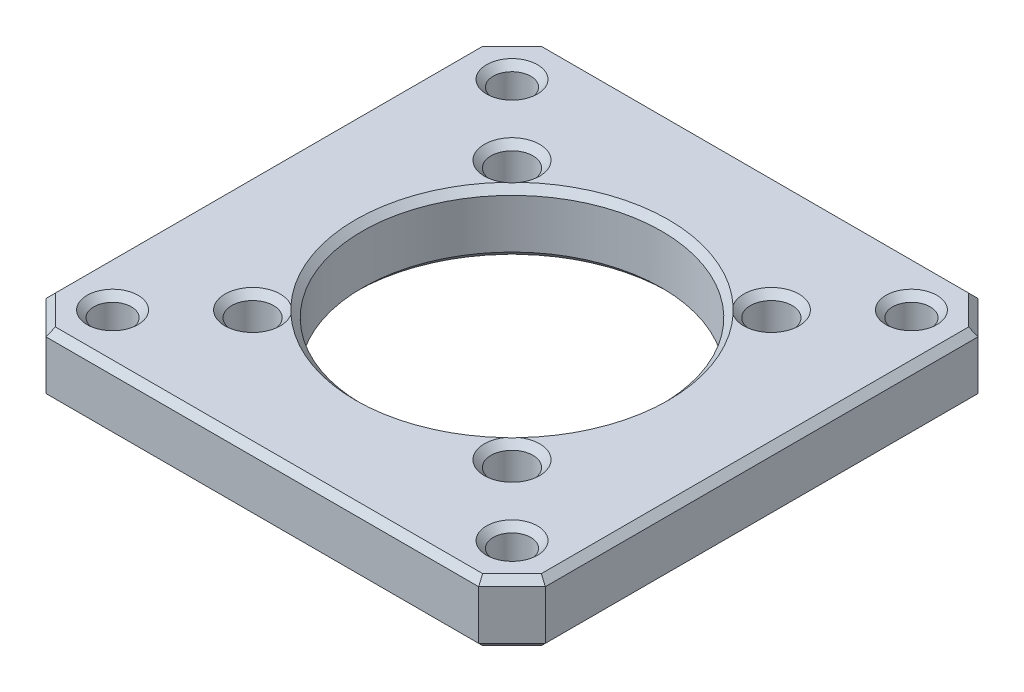
from build123d import *

# Parameters (mm, degrees)
SKETCH1_W           = 38.1
SKETCH1_H           = 38.1
SKETCH1_R           = 11.43
BOSS_EXTRUDE1_DEPTH = 4.7625
SKETCH2_R           = 1.6002
SKETCH2_R_2         = 1.4351
CUT_EXTRUDE1_DEPTH  = 28.358479604
CIRPATTERN1_COUNT   = 4
CHAMFER1_SIZE       = 2.54
CHAMFER2_SIZE       = 0.508


with BuildPart() as part:
    # Sketch1 → Boss-Extrude1 (new body)
    with BuildSketch(Plane(origin=(0, 0, 0), x_dir=(1, 0, 0), z_dir=(0, 1, 0))):
        Rectangle(SKETCH1_W, SKETCH1_H)
        with Locations(Location((0, 0, 0), (0, 0, 90))):
            Circle(SKETCH1_R, mode=Mode.SUBTRACT)
    extrude(amount=BOSS_EXTRUDE1_DEPTH)

    # Sketch2 → Cut-Extrude1 (cut, through all)
    with BuildSketch(Plane(origin=(0, 4.7625, 0), x_dir=(1, 0, 0), z_dir=(0, 1, 0))):
        with Locations(Location((9.896242245, 9.896242245, 0), (0, 0, 270))):
            Circle(SKETCH2_R)
        with Locations(Location((15.24, 15.24, 0), (0, 0, 270))):
            Circle(SKETCH2_R_2)
    cut_extrude1 = extrude(amount=-CUT_EXTRUDE1_DEPTH, mode=Mode.SUBTRACT)

    # CirPattern1: Cut-Extrude1 ×4 about axis
    cirpattern1_axis = Axis((0, 0, 0), (0, 1, 0))
    for i in range(1, CIRPATTERN1_COUNT):
        add(cut_extrude1.rotate(cirpattern1_axis, i * 360 / CIRPATTERN1_COUNT), mode=Mode.SUBTRACT)

    # Chamfer1
    chamfer1_edges = [part.edges().sort_by_distance(p)[0] for p in [
        (19.05, 2.38125, 19.05),
        (-19.05, 2.38125, 19.05),
        (-19.05, 2.38125, -19.05),
        (19.05, 2.38125, -19.05),
    ]]
    chamfer(chamfer1_edges, length=CHAMFER1_SIZE)

    # Chamfer2
    # the kernel refuses this chamfer: 0.508 mm, written as the material it takes off along each edge
    with BuildSketch(Plane(origin=(0, 0, 0), x_dir=(0, 0, -1), z_dir=(1, 0, 0))) as chamfer2_piece_1:
        Polygon((11.43 + CHAMFER2_SIZE, 0), (11.43, CHAMFER2_SIZE), (11.43, 0), align=None)
    revolve(axis=Axis((0, 0, 0), (0, 1, 0)), mode=Mode.SUBTRACT)
    with BuildSketch(Plane(origin=(0, 4.7625, 0), x_dir=(0, 0, -1), z_dir=(1, 0, 0))) as chamfer2_piece_2:
        Polygon((11.43 + CHAMFER2_SIZE, 0), (11.43, -CHAMFER2_SIZE), (11.43, 0), align=None)
    revolve(axis=Axis((0, 4.7625, 0), (0, 1, 0)), mode=Mode.SUBTRACT)
    with BuildSketch(Plane(origin=(9.896242245, 0, -9.896242245), x_dir=(0, 0, 1), z_dir=(-1, 0, 0))) as chamfer2_piece_3:
        Polygon((1.6002 + CHAMFER2_SIZE, 0), (1.6002, CHAMFER2_SIZE), (1.6002, 0), align=None)
    revolve(axis=Axis((9.896242245, 0, -9.896242245), (0, 1, 0)), mode=Mode.SUBTRACT)
    with BuildSketch(Plane(origin=(9.896242245, 4.7625, -9.896242245), x_dir=(0, 0, 1), z_dir=(-1, 0, 0))) as chamfer2_piece_4:
        Polygon((1.6002 + CHAMFER2_SIZE, 0), (1.6002, -CHAMFER2_SIZE), (1.6002, 0), align=None)
    revolve(axis=Axis((9.896242245, 4.7625, -9.896242245), (0, 1, 0)), mode=Mode.SUBTRACT)
    with BuildSketch(Plane(origin=(15.24, 0, -15.24), x_dir=(0, 0, 1), z_dir=(-1, 0, 0))) as chamfer2_piece_5:
        Polygon((1.4351 + CHAMFER2_SIZE, 0), (1.4351, CHAMFER2_SIZE), (1.4351, 0), align=None)
    revolve(axis=Axis((15.24, 0, -15.24), (0, 1, 0)), mode=Mode.SUBTRACT)
    with BuildSketch(Plane(origin=(15.24, 4.7625, -15.24), x_dir=(0, 0, 1), z_dir=(-1, 0, 0))) as chamfer2_piece_6:
        Polygon((1.4351 + CHAMFER2_SIZE, 0), (1.4351, -CHAMFER2_SIZE), (1.4351, 0), align=None)
    revolve(axis=Axis((15.24, 4.7625, -15.24), (0, 1, 0)), mode=Mode.SUBTRACT)
    with BuildSketch(Plane(origin=(-15.24, 0, -15.24), x_dir=(1, 0, 0), z_dir=(0, 0, 1))) as chamfer2_piece_7:
        Polygon((1.4351 + CHAMFER2_SIZE, 0), (1.4351, CHAMFER2_SIZE), (1.4351, 0), align=None)
    revolve(axis=Axis((-15.24, 0, -15.24), (0, 1, 0)), mode=Mode.SUBTRACT)
    with BuildSketch(Plane(origin=(-15.24, 4.7625, -15.24), x_dir=(1, 0, 0), z_dir=(0, 0, 1))) as chamfer2_piece_8:
        Polygon((1.4351 + CHAMFER2_SIZE, 0), (1.4351, -CHAMFER2_SIZE), (1.4351, 0), align=None)
    revolve(axis=Axis((-15.24, 4.7625, -15.24), (0, 1, 0)), mode=Mode.SUBTRACT)
    with BuildSketch(Plane(origin=(15.24, 0, 15.24), x_dir=(-1, 0, 0), z_dir=(0, 0, -1))) as chamfer2_piece_9:
        Polygon((1.4351 + CHAMFER2_SIZE, 0), (1.4351, CHAMFER2_SIZE), (1.4351, 0), align=None)
    revolve(axis=Axis((15.24, 0, 15.24), (0, 1, 0)), mode=Mode.SUBTRACT)
    with BuildSketch(Plane(origin=(15.24, 4.7625, 15.24), x_dir=(-1, 0, 0), z_dir=(0, 0, -1))) as chamfer2_piece_10:
        Polygon((1.4351 + CHAMFER2_SIZE, 0), (1.4351, -CHAMFER2_SIZE), (1.4351, 0), align=None)
    revolve(axis=Axis((15.24, 4.7625, 15.24), (0, 1, 0)), mode=Mode.SUBTRACT)
    with BuildSketch(Plane(origin=(-9.896242245, 0, 9.896242245), x_dir=(0, 0, -1), z_dir=(1, 0, 0))) as chamfer2_piece_11:
        Polygon((1.6002 + CHAMFER2_SIZE, 0), (1.6002, CHAMFER2_SIZE), (1.6002, 0), align=None)
    revolve(axis=Axis((-9.896242245, 0, 9.896242245), (0, 1, 0)), mode=Mode.SUBTRACT)
    with BuildSketch(Plane(origin=(-9.896242245, 4.7625, 9.896242245), x_dir=(0, 0, -1), z_dir=(1, 0, 0))) as chamfer2_piece_12:
        Polygon((1.6002 + CHAMFER2_SIZE, 0), (1.6002, -CHAMFER2_SIZE), (1.6002, 0), align=None)
    revolve(axis=Axis((-9.896242245, 4.7625, 9.896242245), (0, 1, 0)), mode=Mode.SUBTRACT)
    with BuildSketch(Plane(origin=(-15.24, 0, 15.24), x_dir=(0, 0, -1), z_dir=(1, 0, 0))) as chamfer2_piece_13:
        Polygon((1.4351 + CHAMFER2_SIZE, 0), (1.4351, CHAMFER2_SIZE), (1.4351, 0), align=None)
    revolve(axis=Axis((-15.24, 0, 15.24), (0, 1, 0)), mode=Mode.SUBTRACT)
    with BuildSketch(Plane(origin=(-15.24, 4.7625, 15.24), x_dir=(0, 0, -1), z_dir=(1, 0, 0))) as chamfer2_piece_14:
        Polygon((1.4351 + CHAMFER2_SIZE, 0), (1.4351, -CHAMFER2_SIZE), (1.4351, 0), align=None)
    revolve(axis=Axis((-15.24, 4.7625, 15.24), (0, 1, 0)), mode=Mode.SUBTRACT)
    with BuildSketch(Plane(origin=(-9.896242245, 0, -9.896242245), x_dir=(1, 0, 0), z_dir=(0, 0, 1))) as chamfer2_piece_15:
        Polygon((1.6002 + CHAMFER2_SIZE, 0), (1.6002, CHAMFER2_SIZE), (1.6002, 0), align=None)
    revolve(axis=Axis((-9.896242245, 0, -9.896242245), (0, 1, 0)), mode=Mode.SUBTRACT)
    with BuildSketch(Plane(origin=(-9.896242245, 4.7625, -9.896242245), x_dir=(1, 0, 0), z_dir=(0, 0, 1))) as chamfer2_piece_16:
        Polygon((1.6002 + CHAMFER2_SIZE, 0), (1.6002, -CHAMFER2_SIZE), (1.6002, 0), align=None)
    revolve(axis=Axis((-9.896242245, 4.7625, -9.896242245), (0, 1, 0)), mode=Mode.SUBTRACT)
    with BuildSketch(Plane(origin=(9.896242245, 0, 9.896242245), x_dir=(-1, 0, 0), z_dir=(0, 0, -1))) as chamfer2_piece_17:
        Polygon((1.6002 + CHAMFER2_SIZE, 0), (1.6002, CHAMFER2_SIZE), (1.6002, 0), align=None)
    revolve(axis=Axis((9.896242245, 0, 9.896242245), (0, 1, 0)), mode=Mode.SUBTRACT)
    with BuildSketch(Plane(origin=(9.896242245, 4.7625, 9.896242245), x_dir=(-1, 0, 0), z_dir=(0, 0, -1))) as chamfer2_piece_18:
        Polygon((1.6002 + CHAMFER2_SIZE, 0), (1.6002, -CHAMFER2_SIZE), (1.6002, 0), align=None)
    revolve(axis=Axis((9.896242245, 4.7625, 9.896242245), (0, 1, 0)), mode=Mode.SUBTRACT)
    with BuildSketch(Plane(origin=(17.816414958, 0, 19.05), x_dir=(0, -0.027495876610586417, -0.9996219169112968), z_dir=(-1, 0, 0)), Plane(origin=(19.05, 0, -17.816414958), x_dir=(-0.9996219169112968, -0.027495876610586417, 0), z_dir=(0, 0, 1)), Plane(origin=(-19.05, 0, 17.816414958), x_dir=(0.9996219169112968, -0.027495876610586417, 0), z_dir=(0, 0, -1)), Plane(origin=(-17.816414958, 4.7625, -19.05), x_dir=(0, -0.9996219169112968, -0.027495876610587305), z_dir=(1, 0, 0))) as chamfer2_piece_19:
        Polygon((CHAMFER2_SIZE * 0.999621916911, -CHAMFER2_SIZE * 0.0274958766106), (-CHAMFER2_SIZE * 0.0274958766106, -CHAMFER2_SIZE * 0.999621916911), (0, 0), align=None)
    extrude(amount=35.632829916, mode=Mode.SUBTRACT)
    with BuildSketch(Plane(origin=(17.816414958, 4.7625, 19.05), x_dir=(0, 0.027495876610585605, -0.9996219169112968), z_dir=(-1, 0, 0)), Plane(origin=(-17.816414958, 0, -19.05), x_dir=(0, 0.9996219169112968, -0.027495876610587285), z_dir=(1, 0, 0)), Plane(origin=(-19.05, 4.7625, 17.816414958), x_dir=(0.9996219169112968, 0.027495876610585605, 0), z_dir=(0, 0, -1)), Plane(origin=(19.05, 4.7625, -17.816414958), x_dir=(-0.9996219169112968, 0.027495876610585605, 0), z_dir=(0, 0, 1))) as chamfer2_piece_20:
        Polygon((CHAMFER2_SIZE * 0.999621916911, CHAMFER2_SIZE * 0.0274958766106), (-CHAMFER2_SIZE * 0.0274958766106, CHAMFER2_SIZE * 0.999621916911), (0, 0), align=None)
    extrude(amount=35.632829916, mode=Mode.SUBTRACT)
    with BuildSketch(Plane(origin=(-15.586225124, 0, -19.973774876), x_dir=(0.7068394360706735, -0.027495876610586435, 0.7068394360706735), z_dir=(-0.7071067811865476, 0, 0.7071067811865476)), Plane(origin=(-19.973774876, 0, 15.586225124), x_dir=(0.7068394360706735, -0.027495876610586334, -0.7068394360706735), z_dir=(0.7071067811865476, 0, 0.7071067811865476)), Plane(origin=(-15.586225124, 4.7625, -19.973774876), x_dir=(-0.01944252080601412, -0.9996219169112968, -0.01944252080601412), z_dir=(-0.7071067811865476, 0, 0.7071067811865476)), Plane(origin=(19.973774876, 4.7625, 15.586225124), x_dir=(-0.7068394360706735, 0.02749587661058556, -0.7068394360706735), z_dir=(-0.7071067811865476, 0, 0.7071067811865476))) as chamfer2_piece_21:
        Polygon((CHAMFER2_SIZE * 0.999621916911, CHAMFER2_SIZE * 0.0274958766106), (-CHAMFER2_SIZE * 0.0274958766106, CHAMFER2_SIZE * 0.999621916911), (0, 0), align=None)
    extrude(amount=6.204932364, mode=Mode.SUBTRACT)
    with BuildSketch(Plane(origin=(15.586225124, 0, -19.973774876), x_dir=(-0.7068394360706735, -0.027495876610586334, 0.7068394360706735), z_dir=(0.7071067811865476, 0, 0.7071067811865476)), Plane(origin=(19.973774876, 0, 15.586225124), x_dir=(-0.7068394360706735, -0.027495876610586334, -0.7068394360706735), z_dir=(-0.7071067811865476, 0, 0.7071067811865476)), Plane(origin=(15.586225124, 4.7625, -19.973774876), x_dir=(0.01944252080601412, -0.9996219169112968, -0.01944252080601412), z_dir=(0.7071067811865476, 0, 0.7071067811865476)), Plane(origin=(-19.973774876, 4.7625, 15.586225124), x_dir=(0.7068394360706735, 0.02749587661058556, -0.7068394360706735), z_dir=(0.7071067811865476, 0, 0.7071067811865476))) as chamfer2_piece_22:
        Polygon((CHAMFER2_SIZE * 0.999621916911, -CHAMFER2_SIZE * 0.0274958766106), (-CHAMFER2_SIZE * 0.0274958766106, -CHAMFER2_SIZE * 0.999621916911), (0, 0), align=None)
    extrude(amount=6.204932364, mode=Mode.SUBTRACT)


solid = part.part
